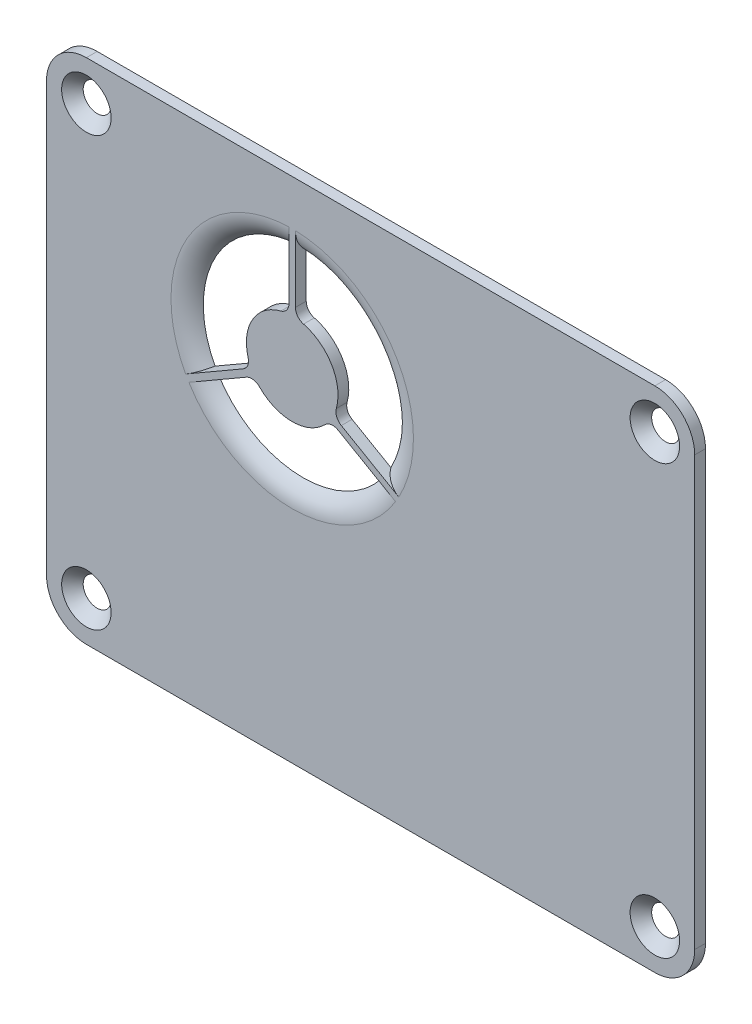
from build123d import *

# Parameters (mm, degrees)
SKETCH1_R                                    = 18.5
SKETCH1_R_2                                  = 2.125
MAIN_DEPTH                                   = 2
INLET_FILLET_R                               = 5
SKETCH20_R                                   = 8.5
FAN_PROTECTION_RIBS_DEPTH                    = 2
FAN_PROTECTION_RIBS_FILLETS_R                = 2
CSK_FOR_M4_HEX_SOCKET_COUNTERSUNK_HE_2_COUNT = 2
CSK_FOR_M4_HEX_SOCKET_COUNTERSUNK_HE_2_PITCH = 79.5
CSK_FOR_M4_HEX_SOCKET_COUNTERSUNK_HE_3_COUNT = 2
CSK_FOR_M4_HEX_SOCKET_COUNTERSUNK_HE_3_PITCH = 105.5
CSK_FOR_M4_HEX_SOCKET_COUNTERSUNK_HE_4_COUNT = 2
CSK_FOR_M4_HEX_SOCKET_COUNTERSUNK_HE_4_PITCH = 132.10034065


with BuildPart() as part:
    # Sketch1 → Main (new body)
    with BuildSketch(Plane.XY):
        with BuildLine():
            Line((-42.95, -46.393826455), (62.55, -46.393826455))
            ThreePointArc((62.55, -46.393826455), (67.782590181, -44.226416636), (69.95, -38.993826455))
            Line((69.95, -38.993826455), (69.95, 40.506173545))
            ThreePointArc((69.95, 40.506173545), (67.782590181, 45.738763726), (62.55, 47.906173545))
            Line((62.55, 47.906173545), (11.070508076, 47.906173545))
            Line((11.070508076, 47.906173545), (-23.570508076, 47.906173545))
            Line((-23.570508076, 47.906173545), (-42.95, 47.906173545))
            ThreePointArc((-42.95, 47.906173545), (-48.182590181, 45.738763726), (-50.35, 40.506173545))
            Line((-50.35, 40.506173545), (-50.35, -38.993826455))
            ThreePointArc((-50.35, -38.993826455), (-48.182590181, -44.226416636), (-42.95, -46.393826455))
        make_face()
        with Locations((-4.75, 17)):
            Circle(SKETCH1_R, mode=Mode.SUBTRACT)
        with Locations((-42.95, 40.506173545)):
            Circle(SKETCH1_R_2, mode=Mode.SUBTRACT)
        with Locations((-42.95, -38.993826455)):
            Circle(SKETCH1_R_2, mode=Mode.SUBTRACT)
        with Locations((62.55, 40.506173545)):
            Circle(SKETCH1_R_2, mode=Mode.SUBTRACT)
        with Locations((62.55, -38.993826455)):
            Circle(SKETCH1_R_2, mode=Mode.SUBTRACT)
    extrude(amount=-MAIN_DEPTH)

    # Inlet Fillet
    # the kernel refuses this fillet: 5 mm, written as the material it takes off along each edge
    with BuildSketch(Plane(origin=(-4.75, 17, 0), x_dir=(1, 0, 0), z_dir=(0, -1, 0))) as inlet_fillet_piece_1:
        with BuildLine():
            CenterArc((22.5, -5), INLET_FILLET_R, 90, 53.130102354)
            Line((22.5, 0), (22.5, 0.1))
            Line((22.5, 0.1), (18.5, 0.1))
            Line((18.5, 0.1), (18.4, 0))
            ThreePointArc((18.4, 0), (18.4, -1), (18.42, -1.94))
            Line((18.42, -1.94), (18.5, -2))
        make_face()
    revolve(axis=Axis((-4.75, 17, 0), (0, 0, 1)), mode=Mode.SUBTRACT)

    # Sketch20 → Fan Protection Ribs (add, through all)
    with BuildSketch(Plane.XY):
        with Locations((-4.75, 17)):
            Circle(SKETCH20_R)
        with BuildLine():
            ThreePointArc((-5.35, 25.478797084), (-4.75, 25.5), (-4.15, 25.478797084))
            Line((-4.15, 25.478797084), (-4.15, 39.491998577))
            ThreePointArc((-4.15, 39.491998577), (-4.75, 39.5), (-5.35, 39.491998577))
            Line((-5.35, 39.491998577), (-5.35, 25.478797084))
        make_face()
        with BuildLine():
            Line((15.02864215, 6.273615954), (2.892853669, 13.2802167))
            ThreePointArc((2.892853669, 13.2802167), (2.611215932, 12.75), (2.292853669, 12.240986215))
            Line((2.292853669, 12.240986215), (14.42864215, 5.234385469))
            ThreePointArc((14.42864215, 5.234385469), (14.735571585, 5.75), (15.02864215, 6.273615954))
        make_face()
        with BuildLine():
            ThreePointArc((-11.792853669, 12.240986215), (-12.111215932, 12.75), (-12.392853669, 13.2802167))
            Line((-12.392853669, 13.2802167), (-24.52864215, 6.273615954))
            ThreePointArc((-24.52864215, 6.273615954), (-24.235571585, 5.75), (-23.92864215, 5.234385469))
            Line((-23.92864215, 5.234385469), (-11.792853669, 12.240986215))
        make_face()
    extrude(amount=-FAN_PROTECTION_RIBS_DEPTH)

    # Fan Protection Ribs Fillets
    fan_protection_ribs_fillets_edges = [part.edges().sort_by_distance(p)[0] for p in [
        (-4.15, 25.478797084, -1),
        (2.892853669, 13.2802167, -1),
        (2.292853669, 12.240986215, -1),
        (-11.792853669, 12.240986215, -1),
        (-12.392853669, 13.2802167, -1),
        (-5.35, 25.478797084, -1),
    ]]
    fillet(fan_protection_ribs_fillets_edges, radius=FAN_PROTECTION_RIBS_FILLETS_R)

    # Sketch23 → CSK for M4 Hex Socket Countersunk Head Screw3 (revolve, cut)
    with BuildSketch(Plane(origin=(-42.95, 40.506173545, 0), x_dir=(0, -1, 0), z_dir=(1, 0, 0))):
        Polygon((0, 0), (0, 2), (2.15, 2), (2.15, 2.44), (4.59, 0), align=None)
    csk_for_m4_hex_socket_countersunk_head_s = revolve(axis=Axis((-42.95, 40.506173545, 6.35), (0, 0, -1)), mode=Mode.SUBTRACT)

    # CSK for M4 Hex Socket Countersunk He 2: CSK for M4 Hex Socket Countersunk Head Screw3 ×2
    with Locations(*[(0, -i * CSK_FOR_M4_HEX_SOCKET_COUNTERSUNK_HE_2_PITCH, 0) for i in range(1, CSK_FOR_M4_HEX_SOCKET_COUNTERSUNK_HE_2_COUNT)]):
        add(csk_for_m4_hex_socket_countersunk_head_s, mode=Mode.SUBTRACT)

    # CSK for M4 Hex Socket Countersunk He 3: CSK for M4 Hex Socket Countersunk Head Screw3 ×2
    with Locations(*[(i * CSK_FOR_M4_HEX_SOCKET_COUNTERSUNK_HE_3_PITCH, 0, 0) for i in range(1, CSK_FOR_M4_HEX_SOCKET_COUNTERSUNK_HE_3_COUNT)]):
        add(csk_for_m4_hex_socket_countersunk_head_s, mode=Mode.SUBTRACT)

    # CSK for M4 Hex Socket Countersunk He 4: CSK for M4 Hex Socket Countersunk Head Screw3 ×2
    with Locations(*[Vector(0.7986353364447739, -0.6018152535303031, 0) * (i * CSK_FOR_M4_HEX_SOCKET_COUNTERSUNK_HE_4_PITCH) for i in range(1, CSK_FOR_M4_HEX_SOCKET_COUNTERSUNK_HE_4_COUNT)]):
        add(csk_for_m4_hex_socket_countersunk_head_s, mode=Mode.SUBTRACT)


solid = part.part
